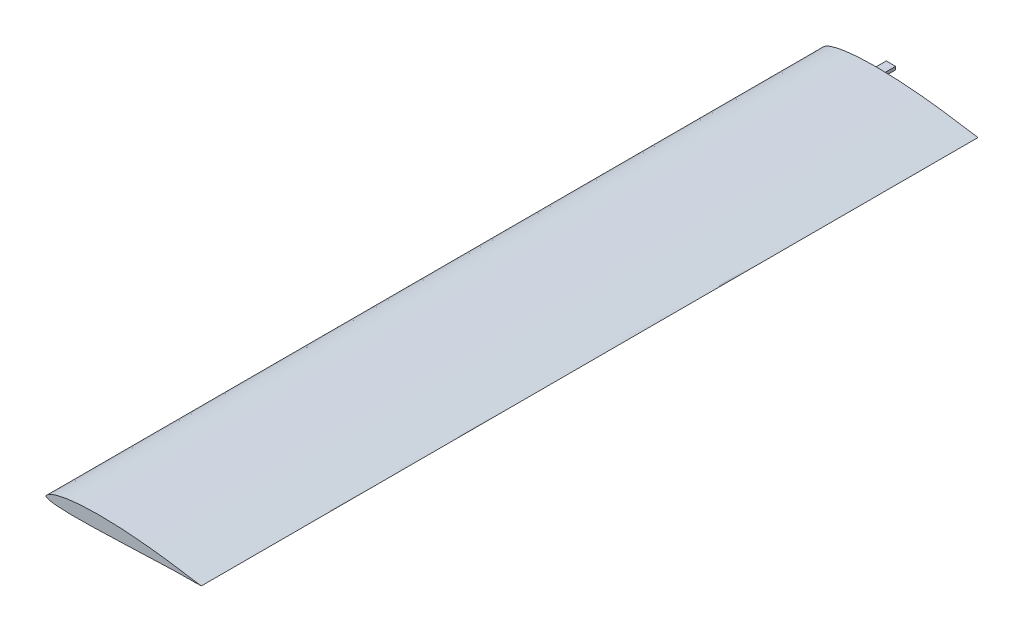
from build123d import *

# Parameters (mm, degrees)
BOSS_EXTRUDE1_DEPTH = 250
SKETCH2_W           = 3
SKETCH2_H           = 1
BOSS_EXTRUDE2_DEPTH = 5


with BuildPart() as part:
    # Sketch1 → Boss-Extrude1 (new body)
    with BuildSketch(Plane.XY):
        with BuildLine():
            add(Edge.make_bspline(
                [(50, 0), (50.000127321, 0.002422792), (49.652184009, 0.032958621), (49.301097208, 0.083188509), (48.459274004, 0.194453497), (47.441479646, 0.349875411), (46.133776608, 0.554864154), (44.615485046, 0.799310742), (42.892312753, 1.07508556), (40.995754148, 1.370980431), (38.94771753, 1.674669482), (36.770322955, 1.971115616), (34.483839246, 2.249761345), (32.108990986, 2.504840128), (29.66860858, 2.732239843), (27.188921164, 2.931782342), (24.697141476, 3.099622867), (22.218817139, 3.225155168), (19.778447637, 3.304800695), (17.399570259, 3.338767304), (15.104318179, 3.320960878), (12.913773107, 3.249229887), (10.847546414, 3.129619148), (8.924509706, 2.959577327), (7.161287843, 2.740428866), (5.571517506, 2.476714534), (4.16707883, 2.17390075), (2.957626952, 1.83762559), (1.950465142, 1.477263452), (1.148816473, 1.103045788), (0.558729346, 0.731078994), (0.228075961, 0.436603357), (0.089992171, 0.239435058), (0.040814575, 0.152213957), (0.010449843, 0.073827097), (-0.001543212, 0.012029906), (0.000871812, -0.036665913), (0.024720092, -0.080378542), (0.069417909, -0.130458815), (0.141050471, -0.188547481), (0.314418628, -0.296228741), (0.700511343, -0.453609623), (1.378093814, -0.628171654), (2.337457247, -0.787734756), (3.538967448, -0.918209355), (4.974167945, -1.015410816), (6.631209203, -1.07934352), (8.495610444, -1.110654464), (10.549669024, -1.111991231), (12.77276295, -1.086785548), (15.141440561, -1.038931402), (17.629849017, -0.972256842), (20.210338001, -0.890564709), (22.853820047, -0.797649566), (25.530288492, -0.69692322), (28.20906111, -0.592479053), (30.859040964, -0.487645246), (33.448999851, -0.386619732), (35.947841946, -0.292376734), (38.325016638, -0.208048773), (40.551004266, -0.135849855), (42.596395244, -0.078478019), (44.436055182, -0.036461301), (46.037752375, -0.009148581), (47.398981695, 0.004310281), (48.444054367, 0.00956179), (49.297247507, 0.004211274), (49.651501088, 0.008982102), (49.999872564, -0.00242498), (50, 0)],
                knots=[0, 0, 0, 0, 0.00163101, 0.006435235, 0.014220669, 0.024765625, 0.037826727, 0.053149348, 0.070473504, 0.089535694, 0.110075428, 0.131859875, 0.154692567, 0.178371256, 0.202679512, 0.227363961, 0.252132687, 0.276728351, 0.300939435, 0.324527111, 0.347267377, 0.368991726, 0.389507471, 0.40862838, 0.426224009, 0.442178728, 0.456395551, 0.468805124, 0.479372318, 0.488085518, 0.494967924, 0.50003381, 0.501035663, 0.50209449, 0.502996978, 0.50351288, 0.503955826, 0.504408894, 0.504955423, 0.505942626, 0.507129614, 0.510997735, 0.518231919, 0.527845532, 0.539808758, 0.554055915, 0.570489592, 0.588973674, 0.609342058, 0.631392897, 0.654894034, 0.679589725, 0.705203145, 0.731446604, 0.758020282, 0.784619628, 0.810935624, 0.836656653, 0.861473352, 0.885081475, 0.907187944, 0.927507338, 0.945765257, 0.961711874, 0.975121793, 0.985796266, 0.993581185, 0.998367518, 1, 1, 1, 1], degree=3))
        make_face()
    extrude(amount=BOSS_EXTRUDE1_DEPTH)

    # Sketch2 → Boss-Extrude2 (add)
    with BuildSketch(Plane(origin=(0, 0, 0), x_dir=(-1, 0, 0), z_dir=(0, 0, -1))):
        with Locations((-16.973, 1.09)):
            Rectangle(SKETCH2_W, SKETCH2_H)
    extrude(amount=BOSS_EXTRUDE2_DEPTH)


solid = part.part
